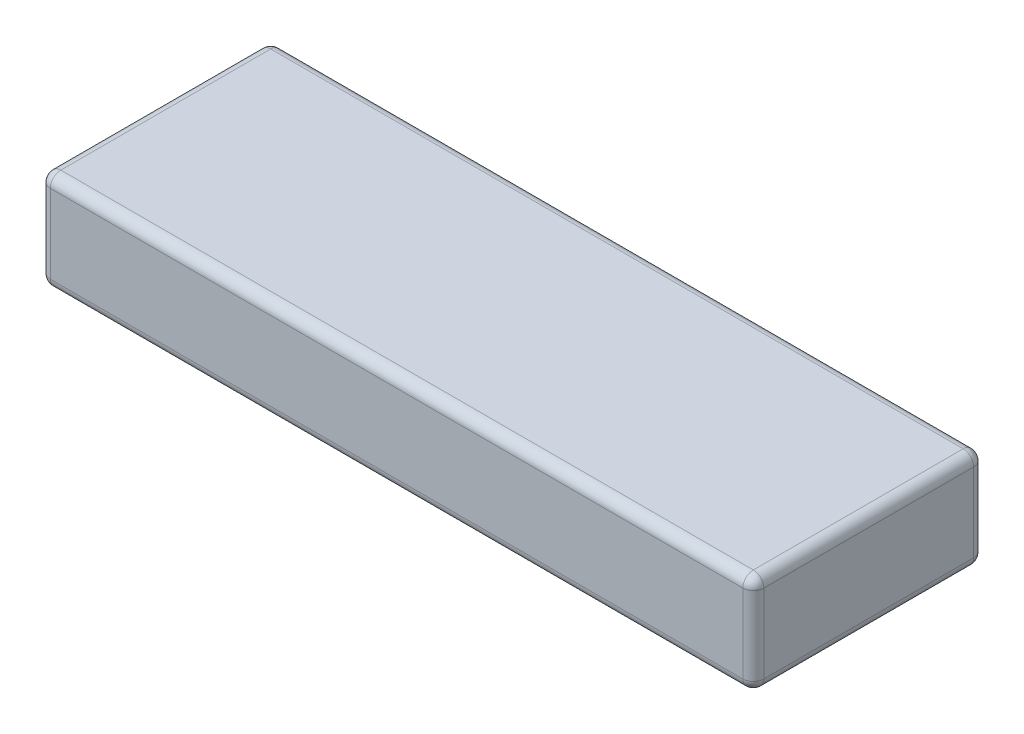
from build123d import *

# Parameters (mm, degrees)
SKETCH1_W           = 136
SKETCH1_H           = 44
BOSS_EXTRUDE1_DEPTH = 19
FILLET1_R           = 2


with BuildPart() as part:
    # Sketch1 → Boss-Extrude1 (new body)
    with BuildSketch(Plane(origin=(0, 0, 0), x_dir=(1, 0, 0), z_dir=(0, 1, 0))):
        Rectangle(SKETCH1_W, SKETCH1_H)
    extrude(amount=BOSS_EXTRUDE1_DEPTH)

    # Fillet1
    fillet1_edges = [part.edges().sort_by_distance(p)[0] for p in [
        (-68, 19, 0),
        (-68, 0, 0),
        (0, 19, -22),
        (-68, 9.5, -22),
        (0, 0, -22),
        (68, 19, 0),
        (68, 9.5, -22),
        (68, 0, 0),
        (-68, 9.5, 22),
        (0, 19, 22),
        (68, 9.5, 22),
        (0, 0, 22),
    ]]
    fillet(fillet1_edges, radius=FILLET1_R)


solid = part.part
